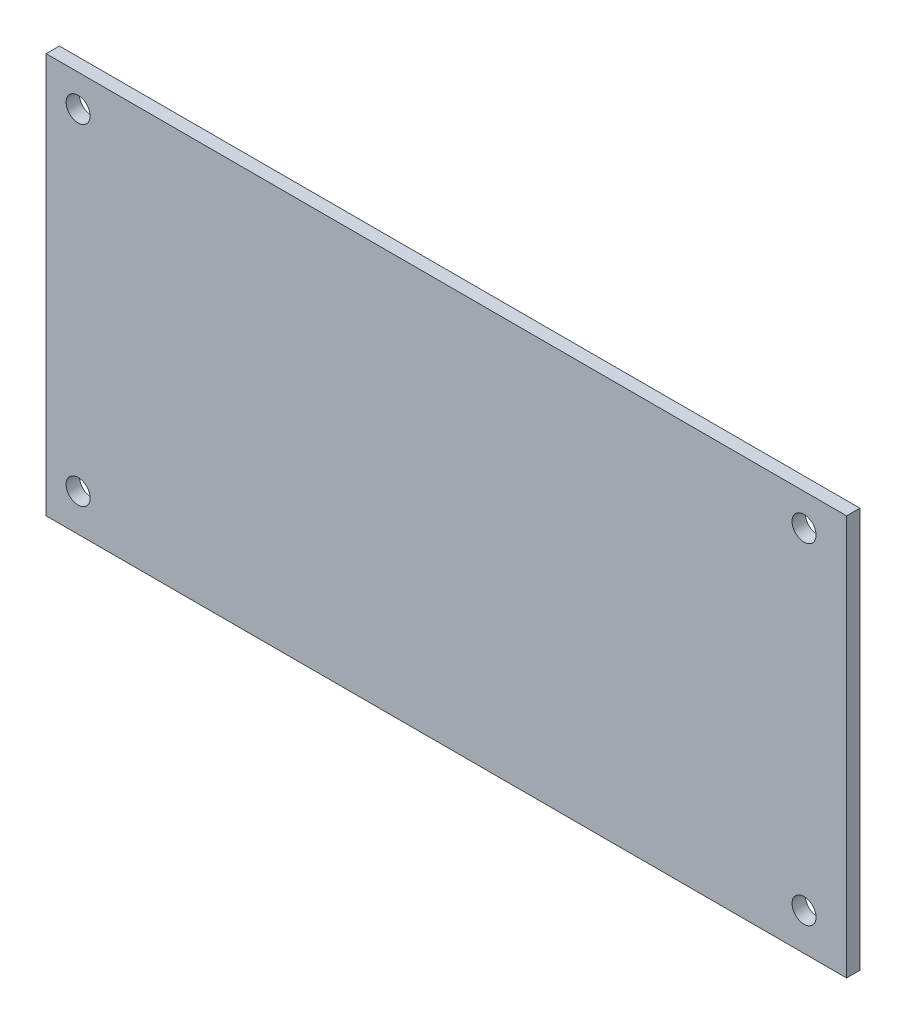
from build123d import *

# Parameters (mm, degrees)
ESQUISSE1_W        = 100
ESQUISSE1_H        = 50
ESQUISSE1_R        = 1.5
BOSS_EXTRU_1_DEPTH = 1.66


with BuildPart() as part:
    # Esquisse1 → Boss.-Extru.1 (new body)
    with BuildSketch(Plane.XY):
        Rectangle(ESQUISSE1_W, ESQUISSE1_H)
        with Locations((-46, 21)):
            Circle(ESQUISSE1_R, mode=Mode.SUBTRACT)
        with Locations((-46, -20.342041491)):
            Circle(ESQUISSE1_R, mode=Mode.SUBTRACT)
        with Locations((44.684082983, 21)):
            Circle(ESQUISSE1_R, mode=Mode.SUBTRACT)
        with Locations((44.684082983, -20.342041491)):
            Circle(ESQUISSE1_R, mode=Mode.SUBTRACT)
    extrude(amount=BOSS_EXTRU_1_DEPTH)


solid = part.part
